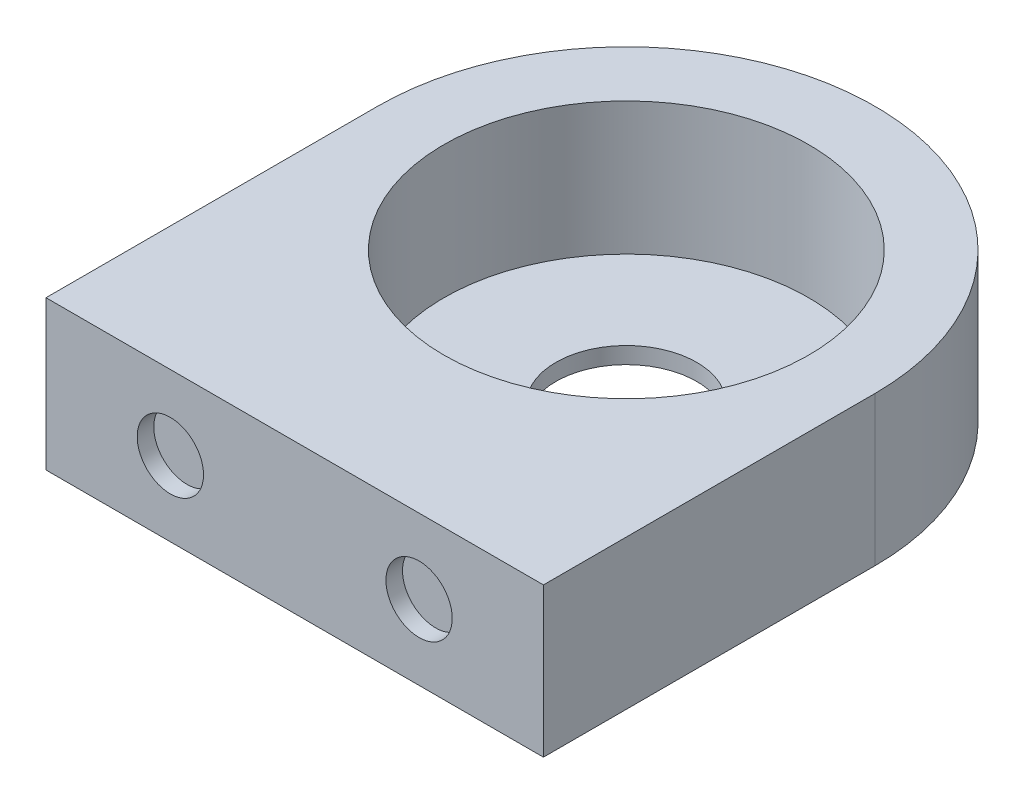
from build123d import *

# Parameters (mm, degrees)
SKETCH1_R           = 4.25
BOSS_EXTRUDE1_DEPTH = 9
SKETCH2_R           = 11
CUT_EXTRUDE1_DEPTH  = 8
SKETCH4_R           = 2
CUT_EXTRUDE2_DEPTH  = 1


with BuildPart() as part:
    # Sketch1 → Boss-Extrude1 (new body)
    with BuildSketch(Plane(origin=(0, 0, 0), x_dir=(1, 0, 0), z_dir=(0, 1, 0))):
        with BuildLine():
            Line((0, 0), (30, 0))
            Line((30, 0), (30, 20))
            ThreePointArc((30, 20), (15, 35), (0, 20))
            Line((0, 20), (0, 0))
        make_face()
        with Locations((15, 20)):
            Circle(SKETCH1_R, mode=Mode.SUBTRACT)
    extrude(amount=BOSS_EXTRUDE1_DEPTH)

    # Sketch2 → Cut-Extrude1 (cut)
    with BuildSketch(Plane(origin=(0, 9, 0), x_dir=(1, 0, 0), z_dir=(0, 1, 0))):
        with Locations((15, 20)):
            Circle(SKETCH2_R)
    extrude(amount=-CUT_EXTRUDE1_DEPTH, mode=Mode.SUBTRACT)

    # Sketch4 → Cut-Extrude2 (cut)
    with BuildSketch(Plane.XY):
        with Locations((7.5, 4.5)):
            Circle(SKETCH4_R)
        with Locations((22.5, 4.5)):
            Circle(SKETCH4_R)
    extrude(amount=-CUT_EXTRUDE2_DEPTH, mode=Mode.SUBTRACT)


solid = part.part
